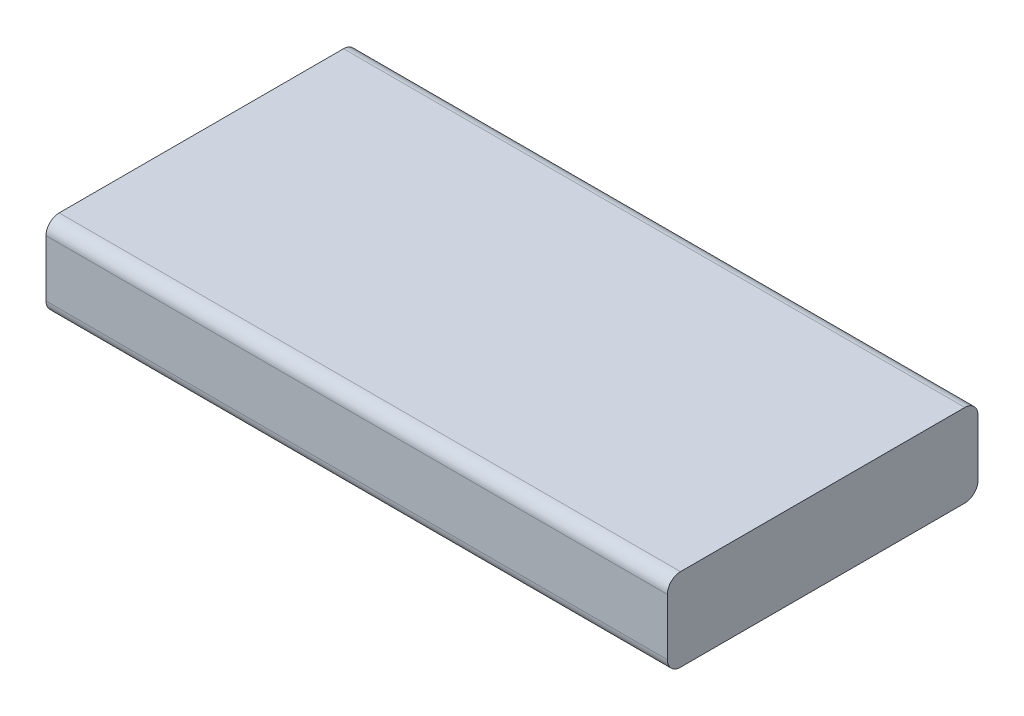
from build123d import *

# Parameters (mm, degrees)
SKETCH1_W           = 30
SKETCH1_H           = 15
BOSS_EXTRUDE1_DEPTH = 4
FILLET1_R           = 0.635


with BuildPart() as part:
    # Sketch1 → Boss-Extrude1 (new body)
    with BuildSketch(Plane(origin=(0, 0, 0), x_dir=(1, 0, 0), z_dir=(0, 1, 0))):
        with Locations((15, 7.5)):
            Rectangle(SKETCH1_W, SKETCH1_H)
    extrude(amount=BOSS_EXTRUDE1_DEPTH)

    # Fillet1
    fillet1_edges = [part.edges().sort_by_distance(p)[0] for p in [
        (15, 0, -15),
        (15, 4, -15),
        (15, 0, 0),
        (15, 4, 0),
    ]]
    fillet(fillet1_edges, radius=FILLET1_R)


solid = part.part
